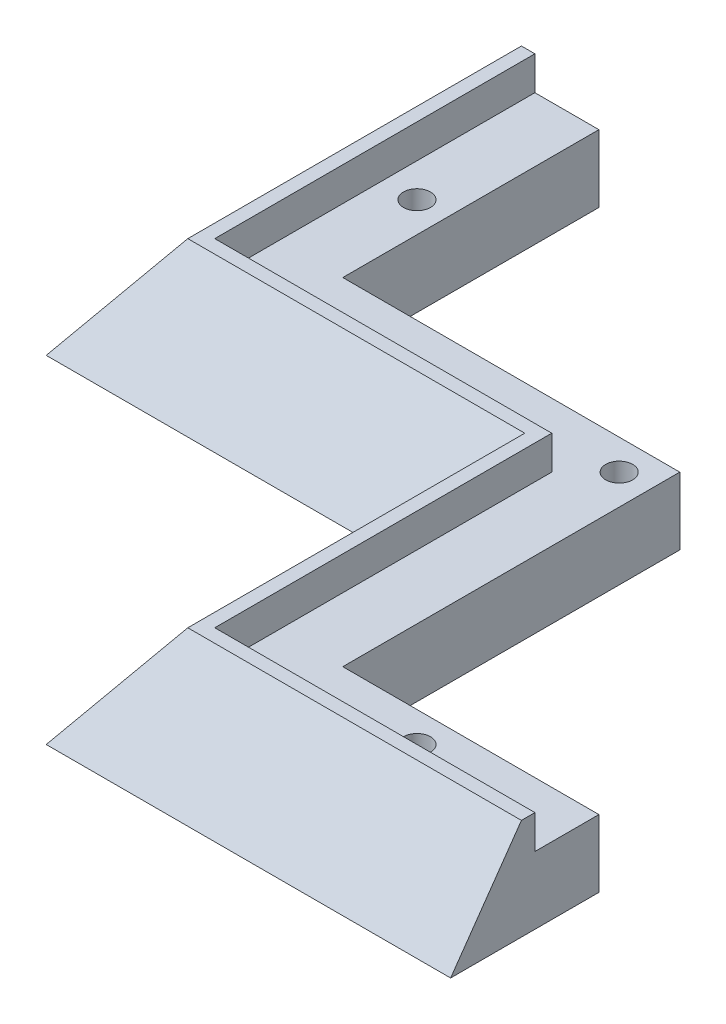
from build123d import *
from OCP.BRepFilletAPI import BRepFilletAPI_MakeChamfer

# Parameters (mm, degrees)
BOSS_EXTRU_1_DEPTH      = 15
CHANFREIN1_SIZE         = 15
CHANFREIN1_SIZE_2       = 10.503113073
ESQUISSE4_R             = 2
ENL_V_MAT_EXTRU_3_DEPTH = 4
ENL_V_MAT_EXTRU_5_DEPTH = 5
ESQUISSE6_R             = 2
ENL_V_MAT_EXTRU_6_DEPTH = 5


with BuildPart() as part:
    # Esquisse1 → Boss.-Extru.1 (new body)
    with BuildSketch(Plane(origin=(0, 0, 0), x_dir=(1, 0, 0), z_dir=(0, 1, 0))):
        Polygon((-41.352348911, -18.647651089), (8.647651089, -18.647651089), (8.647651089, -68.647651089), (68.647651089, -68.647651089), (68.647651089, -46.647651089), (30.647651089, -46.647651089), (30.647651089, 3.352348911), (-19.352348911, 3.352348911), (-19.352348911, 41.352348911), (-41.352348911, 41.352348911), align=None)
    extrude(amount=BOSS_EXTRU_1_DEPTH)

    # Chanfrein1
    chanfrein1_edges_1 = [part.edges().sort_by_distance(p)[0] for p in [
        (38.647651089, 15, 68.647651089),
    ]]
    chanfrein1_side_1 = [part.faces().sort_by_distance(p)[0] for p in [
        (38.647651089, 14.789937739, 68.647651089),
    ]]
    chanfrein1_edges_2 = [part.edges().sort_by_distance(p)[0] for p in [
        (8.647651089, 15, 43.647651089),
    ]]
    chanfrein1_side_2 = [part.faces().sort_by_distance(p)[0] for p in [
        (8.647651089, 14.789937739, 43.647651089),
    ]]
    chanfrein1_edges_3 = [part.edges().sort_by_distance(p)[0] for p in [
        (-16.352348911, 15, 18.647651089),
    ]]
    chanfrein1_side_3 = [part.faces().sort_by_distance(p)[0] for p in [
        (-16.352348911, 14.789937739, 18.647651089),
    ]]
    chanfrein1_edges_4 = [part.edges().sort_by_distance(p)[0] for p in [
        (-41.352348911, 15, -11.352348911),
    ]]
    chanfrein1_side_4 = [part.faces().sort_by_distance(p)[0] for p in [
        (-41.352348911, 14.789937739, -11.352348911),
    ]]
    chanfrein1 = BRepFilletAPI_MakeChamfer(part.part.solid().wrapped)
    for e in chanfrein1_edges_1:
        chanfrein1.Add(CHANFREIN1_SIZE - 0.0001, CHANFREIN1_SIZE_2 - 0.0001, e.wrapped, chanfrein1_side_1[0].wrapped)
    for e in chanfrein1_edges_2:
        chanfrein1.Add(CHANFREIN1_SIZE - 0.0001, CHANFREIN1_SIZE_2 - 0.0001, e.wrapped, chanfrein1_side_2[0].wrapped)
    for e in chanfrein1_edges_3:
        chanfrein1.Add(CHANFREIN1_SIZE - 0.0001, CHANFREIN1_SIZE_2 - 0.0001, e.wrapped, chanfrein1_side_3[0].wrapped)
    for e in chanfrein1_edges_4:
        chanfrein1.Add(CHANFREIN1_SIZE - 0.0001, CHANFREIN1_SIZE_2 - 0.0001, e.wrapped, chanfrein1_side_4[0].wrapped)
    add(Compound.cast(chanfrein1.Shape()), mode=Mode.REPLACE)  # a hair under: the kernel refuses the full size

    # Esquisse4 → Enlèv. mat.-Extru.3 (cut)
    with BuildSketch(Plane.XZ):
        with Locations(Location((38.647651089, 63.647651089, 0), (0, 0, 270))):
            Circle(ESQUISSE4_R)
        with Locations(Location((13.647651089, 38.647651089, 0), (0, 0, 270))):
            Circle(ESQUISSE4_R)
        with Locations(Location((-11.352348911, 13.647651089, 0), (0, 0, 270))):
            Circle(ESQUISSE4_R)
    extrude(amount=-ENL_V_MAT_EXTRU_3_DEPTH, mode=Mode.SUBTRACT)

    # Esquisse5 → Enlèv. mat.-Extru.5 (cut)
    with BuildSketch(Plane(origin=(0, 15, 0), x_dir=(1, 0, 0), z_dir=(0, 1, 0))):
        Polygon((-28.849235838, 41.352348911), (-19.352348911, 41.352348911), (-19.352348911, 3.352348911), (30.647651089, 3.352348911), (30.647651089, -46.647651089), (68.647651089, -46.647651089), (68.647651089, -56.140382231), (21.150764162, -56.140382231), (21.150764162, -6.144538016), (-28.849235838, -6.144538016), align=None)
    extrude(amount=-ENL_V_MAT_EXTRU_5_DEPTH, mode=Mode.SUBTRACT)

    # Esquisse6 → Enlèv. mat.-Extru.6 (cut)
    with BuildSketch(Plane(origin=(0, 10, 0), x_dir=(1, 0, 0), z_dir=(0, 1, 0))):
        with Locations(Location((-23.849235838, 18.855461984, 0), (0, 0, 270))):
            Circle(ESQUISSE6_R)
        with Locations(Location((26.150764162, -1.144538016, 0), (0, 0, 270))):
            Circle(ESQUISSE6_R)
        with Locations(Location((46.150764162, -51.140382231, 0), (0, 0, 270))):
            Circle(ESQUISSE6_R)
    extrude(amount=-ENL_V_MAT_EXTRU_6_DEPTH, mode=Mode.SUBTRACT)


solid = part.part
